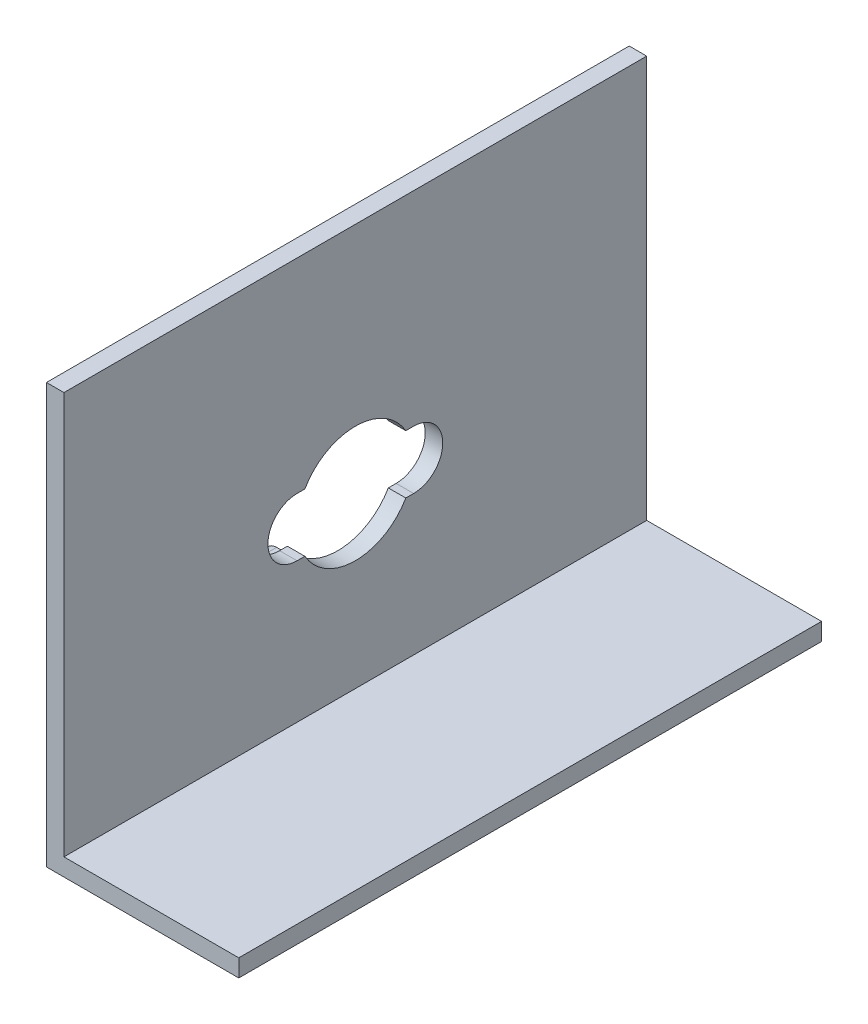
from build123d import *

# Parameters (mm, degrees)
BOSS_EXTRUDE1_DEPTH = 100
CUT_EXTRUDE1_DEPTH  = 100
BOSS_EXTRUDE3_DEPTH = 2.5
FILLET4_R           = 0.5
FILLET5_R           = 2


with BuildPart() as part:
    # Sketch1 → Boss-Extrude1 (new body)
    with BuildSketch(Plane.XY):
        Polygon((0, 72), (3, 72), (3, 3), (33, 3), (33, 0), (0, 0), align=None)
    extrude(amount=BOSS_EXTRUDE1_DEPTH)

    # Sketch2 → Cut-Extrude1 (cut)
    with BuildSketch(Plane.ZY):
        with BuildLine():
            Line((58.660254038, 37), (60, 37))
            ThreePointArc((60, 37), (65, 32), (60, 27))
            Line((60, 27), (58.660254038, 27))
            ThreePointArc((58.660254038, 27), (50, 22), (41.339745962, 27))
            Line((41.339745962, 27), (40, 27))
            ThreePointArc((40, 27), (35, 32), (40, 37))
            Line((40, 37), (41.339745962, 37))
            ThreePointArc((41.339745962, 37), (50, 42), (58.660254038, 37))
        make_face()
    extrude(amount=-CUT_EXTRUDE1_DEPTH, mode=Mode.SUBTRACT)

    # Sketch7 → Boss-Extrude3 (add, symmetric)
    with BuildSketch(Plane(origin=(0, 0, 50), x_dir=(-1, 0, 0), z_dir=(0, 0, -1))):
        Polygon((0, 14.75), (15, 14.75), (15, 10.75), (14, 10.75), (12.75, 12.25), (0, 12.25), align=None)
        Polygon((0, 4.5), (0, 2), (15, 2), (15, 6), (14, 6), (12.75, 4.5), align=None)
    extrude(amount=BOSS_EXTRUDE3_DEPTH, both=True)

    # Fillet4
    fillet4_edges = [part.edges().sort_by_distance(p)[0] for p in [
        (-12.75, 12.25, 50),
        (-14, 10.75, 50),
        (-15, 10.75, 50),
        (-12.75, 4.5, 50),
        (-14, 6, 50),
        (-15, 6, 50),
    ]]
    fillet(fillet4_edges, radius=FILLET4_R)

    # Fillet5
    fillet5_edges = [part.edges().sort_by_distance(p)[0] for p in [
        (-15, 14.75, 50),
        (-15, 2, 50),
    ]]
    fillet(fillet5_edges, radius=FILLET5_R)


solid = part.part
